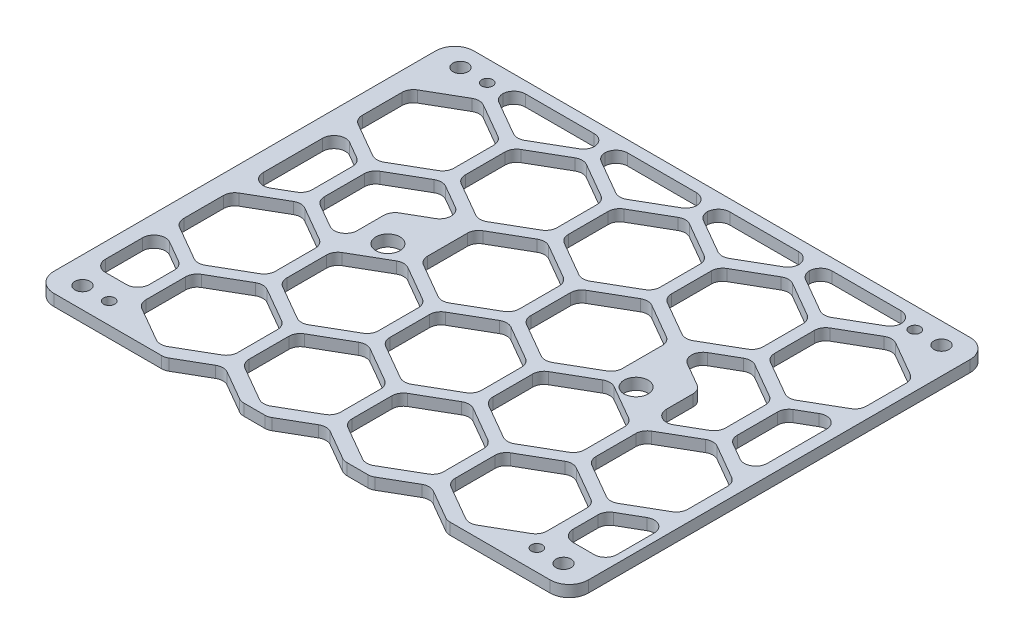
from build123d import *

# Parameters (mm, degrees)
SKETCH_1_W          = 140
SKETCH_1_H          = 110
SKETCH_1_R          = 1.975
SKETCH_1_R_2        = 1.45
EXTRUDE_1_DEPTH     = 1.5
FILLET_1_R          = 5
SKETCH_3_R          = 3.15
CUT_EXTRUDE_2_DEPTH = 90.073003767
CUT_EXTRUDE_3_DEPTH = 90.073003767
FILLET_2_R          = 3
FILLET_3_R          = 3


with BuildPart() as part:
    # 草图1 → 凸台-拉伸1 (new, symmetric)
    with BuildSketch(Plane(origin=(0, 0, 0), x_dir=(1, 0, 0), z_dir=(0, 1, 0))):
        Rectangle(SKETCH_1_W, SKETCH_1_H)
        with Locations(Location((-63, 49.5, 0), (0, 0, 270))):
            Circle(SKETCH_1_R, mode=Mode.SUBTRACT)
        with Locations(Location((63, 49.5, 0), (0, 0, 270))):
            Circle(SKETCH_1_R, mode=Mode.SUBTRACT)
        with Locations(Location((63, -49.5, 0), (0, 0, 270))):
            Circle(SKETCH_1_R, mode=Mode.SUBTRACT)
        with Locations(Location((-63, -49.5, 0), (0, 0, 270))):
            Circle(SKETCH_1_R, mode=Mode.SUBTRACT)
        with Locations(Location((-56, 49.5, 0), (0, 0, 270))):
            Circle(SKETCH_1_R_2, mode=Mode.SUBTRACT)
        with Locations(Location((56, 49.5, 0), (0, 0, 270))):
            Circle(SKETCH_1_R_2, mode=Mode.SUBTRACT)
        with Locations(Location((56, -49.5, 0), (0, 0, 270))):
            Circle(SKETCH_1_R_2, mode=Mode.SUBTRACT)
        with Locations(Location((-56, -49.5, 0), (0, 0, 270))):
            Circle(SKETCH_1_R_2, mode=Mode.SUBTRACT)
    extrude(amount=EXTRUDE_1_DEPTH, both=True)

    # 圆角1
    fillet_1_edges = [part.edges().sort_by_distance(p)[0] for p in [
        (70, 0, 55),
        (-70, 0, 55),
        (-70, 0, -55),
        (70, 0, -55),
    ]]
    fillet(fillet_1_edges, radius=FILLET_1_R)

    # 草图3 → 切除-拉伸2 (cut, through all)
    with BuildSketch(Plane(origin=(0, 1.5, 0), x_dir=(1, 0, 0), z_dir=(0, 1, 0))):
        with Locations(Location((-32.5, 0, 0), (0, 0, 270))):
            Circle(SKETCH_3_R)
        with Locations(Location((32.5, 0, 0), (0, 0, 270))):
            Circle(SKETCH_3_R)
    extrude(amount=-CUT_EXTRUDE_2_DEPTH, mode=Mode.SUBTRACT)

    # 草图4 → 切除-拉伸3 (cut, through all)
    with BuildSketch(Plane(origin=(0, 1.5, 0), x_dir=(1, 0, 0), z_dir=(0, 1, 0))):
        Polygon((-53, 44.856406461), (-65, 37.92820323), (-65, 24.07179677), (-53, 17.143593539), (-41, 24.07179677), (-41, 37.92820323), align=None)
        Polygon((-26, 44.856406461), (-38, 37.92820323), (-38, 24.07179677), (-26, 17.143593539), (-14, 24.07179677), (-14, 37.92820323), align=None)
        Polygon((1, 44.856406461), (-11, 37.92820323), (-11, 24.07179677), (1, 17.143593539), (13, 24.07179677), (13, 37.92820323), align=None)
        Polygon((28, 44.856406461), (16, 37.92820323), (16, 24.07179677), (28, 17.143593539), (40, 24.07179677), (40, 37.92820323), align=None)
        Polygon((55, 44.856406461), (43, 37.92820323), (43, 24.07179677), (55, 17.143593539), (67, 24.07179677), (67, 37.92820323), align=None)
        Polygon((-26, -1.913593539), (-38, -8.84179677), (-38, -22.69820323), (-26, -29.626406461), (-14, -22.69820323), (-14, -8.84179677), align=None)
        Polygon((1, -1.913593539), (-11, -8.84179677), (-11, -22.69820323), (1, -29.626406461), (13, -22.69820323), (13, -8.84179677), align=None)
        Polygon((28, -1.913593539), (16, -8.84179677), (16, -22.69820323), (28, -29.626406461), (40, -22.69820323), (40, -8.84179677), align=None)
        Polygon((55, -1.913593539), (43, -8.84179677), (43, -22.69820323), (55, -29.626406461), (67, -22.69820323), (67, -8.84179677), align=None)
        Polygon((-53, -1.913593539), (-65, -8.84179677), (-65, -22.69820323), (-53, -29.626406461), (-41, -22.69820323), (-41, -8.84179677), align=None)
        Polygon((-12.5, 21.473720558), (-24.5, 14.545517328), (-24.5, 0.689110868), (-12.5, -6.239092363), (-0.5, 0.689110868), (-0.5, 14.545517328), align=None)
        Polygon((14.5, 21.473720558), (2.5, 14.545517328), (2.5, 0.689110868), (14.5, -6.239092363), (26.5, 0.689110868), (26.5, 14.545517328), align=None)
        Polygon((-12.5, -25.296279442), (-24.5, -32.224482672), (-24.5, -46.080889132), (-12.5, -53.009092363), (-0.5, -46.080889132), (-0.5, -32.224482672), align=None)
        Polygon((14.5, -25.296279442), (2.5, -32.224482672), (2.5, -46.080889132), (14.5, -53.009092363), (26.5, -46.080889132), (26.5, -32.224482672), align=None)
        Polygon((41.5, -25.296279442), (29.5, -32.224482672), (29.5, -46.080889132), (41.5, -53.009092363), (53.5, -46.080889132), (53.5, -32.224482672), align=None)
        Polygon((-39.5, -25.296279442), (-51.5, -32.224482672), (-51.5, -46.080889132), (-39.5, -53.009092363), (-27.5, -46.080889132), (-27.5, -32.224482672), align=None)
        Polygon((-27.5, 14.545517328), (-39.5, 7.617314098), (-39.5, -6.239092363), (-51.5, 0.689110868), (-51.5, 14.545517328), (-39.5, 21.473720558), align=None)
        Polygon((29.5, 14.545517328), (41.5, 7.617314098), (41.5, -6.239092363), (53.5, 0.689110868), (53.5, 14.545517328), (41.5, 21.473720558), align=None)
        Polygon((-65, 20.57179677), (-54.682525344, 14.615), (-54.682525344, 0.615), (-65, -5.34179677), align=None)
        Polygon((56.682525344, 0.615), (67, -5.34179677), (67, 20.57179677), (56.682525344, 14.615), align=None)
        Polygon((-66, -25.584954576), (-66, -43.5), (-54.5, -43.5), (-54.5, -32.224482672), align=None)
        Polygon((56.5, -43.5), (56.5, -32.224482672), (68, -25.584954576), (68, -43.5), align=None)
        Polygon((-51.5, 52), (-51.5, 47.454482672), (-39.5, 40.526279442), (-27.5, 47.454482672), (-27.5, 52), align=None)
        Polygon((-0.725, 52), (-24.725, 52), (-24.725, 47.454482672), (-12.725, 40.526279442), (-0.725, 47.454482672), align=None)
        Polygon((26.05, 52), (2.05, 52), (2.05, 47.454482672), (14.05, 40.526279442), (26.05, 47.454482672), align=None)
        Polygon((52.825, 52), (28.825, 52), (28.825, 47.454482672), (40.825, 40.526279442), (52.825, 47.454482672), align=None)
        Polygon((-35.948353181, -55), (-26, -49.256315613), (-16.051646819, -55), align=None)
        Polygon((10.948353181, -55), (-8.948353181, -55), (1, -49.256315613), align=None)
        Polygon((37.948353181, -55), (18.051646819, -55), (28, -49.256315613), align=None)
    extrude(amount=-CUT_EXTRUDE_3_DEPTH, mode=Mode.SUBTRACT)

    # 圆角2
    # the kernel refuses this fillet: 3 mm, written as the material it adds along each edge
    with BuildSketch(Plane(origin=(41.5, 1.5, 6.239092363), x_dir=(0, 0, -1), z_dir=(0, -1, 0)), Plane(origin=(-39.5, 1.5, 6.239092363), x_dir=(-0.8660254037844385, 0, -0.5000000000000002), z_dir=(0, -1, 0)), Plane(origin=(-65, 1.5, 5.34179677), x_dir=(0, 0, -1), z_dir=(0, -1, 0)), Plane(origin=(67, 1.5, -20.57179677), x_dir=(0, 0, 1), z_dir=(0, -1, 0)), Plane(origin=(67, 1.5, 5.34179677), x_dir=(-0.8660254037844393, 0, -0.49999999999999906), z_dir=(0, -1, 0)), Plane(origin=(68, 1.5, 25.584954576), x_dir=(0, 0, 1), z_dir=(0, -1, 0))) as fillet_2_piece_1:
        with BuildLine():
            CenterArc((FILLET_2_R * 1.73205080757, FILLET_2_R), FILLET_2_R, 150, 120)
            Line((FILLET_2_R * 0.866025403784, FILLET_2_R * 1.5), (0, 0))
            Line((0, 0), (FILLET_2_R * 1.73205080757, 0))
        make_face()
    extrude(amount=3)
    with BuildSketch(Plane(origin=(29.5, 1.5, -14.545517328), x_dir=(0.8660254037844386, 0, 0.5), z_dir=(0, -1, 0)), Plane(origin=(-27.5, 1.5, -14.545517328), x_dir=(-0.8660254037844392, 0, -0.4999999999999992), z_dir=(0, -1, 0)), Plane(origin=(-65, 1.5, -20.57179677), x_dir=(0, 0, 1), z_dir=(0, -1, 0)), Plane(origin=(-66, 1.5, 25.584954576), x_dir=(0, 0, 1), z_dir=(0, -1, 0))) as fillet_2_piece_2:
        with BuildLine():
            CenterArc((FILLET_2_R * 1.73205080757, -FILLET_2_R), FILLET_2_R, 90, 120)
            Line((FILLET_2_R * 0.866025403784, -FILLET_2_R * 1.5), (0, 0))
            Line((0, 0), (FILLET_2_R * 1.73205080757, 0))
        make_face()
    extrude(amount=3)
    with BuildSketch(Plane(origin=(41.5, 1.5, -21.473720558), x_dir=(0.8660254037844389, 0, 0.4999999999999995), z_dir=(0, -1, 0)), Plane(origin=(53.5, 1.5, -14.545517328), x_dir=(0, 0, 1), z_dir=(0, -1, 0)), Plane(origin=(53.5, 1.5, -0.689110868), x_dir=(-0.8660254037844385, 0, 0.5000000000000003), z_dir=(0, -1, 0)), Plane(origin=(-51.5, 1.5, -0.689110868), x_dir=(0, 0, -1), z_dir=(0, -1, 0)), Plane(origin=(-51.5, 1.5, -14.545517328), x_dir=(0.8660254037844389, 0, -0.4999999999999995), z_dir=(0, -1, 0)), Plane(origin=(-39.5, 1.5, -21.473720558), x_dir=(0.8660254037844392, 0, 0.4999999999999993), z_dir=(0, -1, 0)), Plane(origin=(-41, 1.5, 8.84179677), x_dir=(0, 0, 1), z_dir=(0, -1, 0)), Plane(origin=(-41, 1.5, 22.69820323), x_dir=(-0.8660254037844379, 0, 0.5000000000000013), z_dir=(0, -1, 0)), Plane(origin=(-53, 1.5, 29.626406461), x_dir=(-0.8660254037844389, 0, -0.4999999999999995), z_dir=(0, -1, 0)), Plane(origin=(-65, 1.5, 22.69820323), x_dir=(0, 0, -1), z_dir=(0, -1, 0)), Plane(origin=(-65, 1.5, 8.84179677), x_dir=(0.8660254037844394, 0, -0.4999999999999987), z_dir=(0, -1, 0)), Plane(origin=(67, 1.5, 8.84179677), x_dir=(0, 0, 1), z_dir=(0, -1, 0)), Plane(origin=(67, 1.5, 22.69820323), x_dir=(-0.8660254037844389, 0, 0.4999999999999995), z_dir=(0, -1, 0)), Plane(origin=(55, 1.5, 29.626406461), x_dir=(-0.8660254037844389, 0, -0.4999999999999995), z_dir=(0, -1, 0)), Plane(origin=(43, 1.5, 22.69820323), x_dir=(0, 0, -1), z_dir=(0, -1, 0)), Plane(origin=(43, 1.5, 8.84179677), x_dir=(0.8660254037844394, 0, -0.4999999999999987), z_dir=(0, -1, 0)), Plane(origin=(-0.5, 1.5, -14.545517328), x_dir=(0, 0, 1), z_dir=(0, -1, 0)), Plane(origin=(-0.5, 1.5, -0.689110868), x_dir=(-0.866025403784439, 0, 0.4999999999999993), z_dir=(0, -1, 0)), Plane(origin=(-12.5, 1.5, 6.239092363), x_dir=(-0.8660254037844387, 0, -0.4999999999999999), z_dir=(0, -1, 0)), Plane(origin=(-24.5, 1.5, -0.689110868), x_dir=(0, 0, -1), z_dir=(0, -1, 0)), Plane(origin=(-24.5, 1.5, -14.545517328), x_dir=(0.8660254037844384, 0, -0.5000000000000003), z_dir=(0, -1, 0)), Plane(origin=(26.5, 1.5, -14.545517328), x_dir=(0, 0, 1), z_dir=(0, -1, 0)), Plane(origin=(26.5, 1.5, -0.689110868), x_dir=(-0.8660254037844385, 0, 0.5000000000000002), z_dir=(0, -1, 0)), Plane(origin=(14.5, 1.5, 6.239092363), x_dir=(-0.8660254037844387, 0, -0.4999999999999999), z_dir=(0, -1, 0)), Plane(origin=(2.5, 1.5, -0.689110868), x_dir=(0, 0, -1), z_dir=(0, -1, 0)), Plane(origin=(2.5, 1.5, -14.545517328), x_dir=(0.8660254037844386, 0, -0.5000000000000002), z_dir=(0, -1, 0)), Plane(origin=(-0.5, 1.5, 32.224482672), x_dir=(0, 0, 1), z_dir=(0, -1, 0)), Plane(origin=(-0.5, 1.5, 46.080889132), x_dir=(-0.8660254037844382, 0, 0.500000000000001), z_dir=(0, -1, 0)), Plane(origin=(-12.5, 1.5, 53.009092363), x_dir=(-0.8660254037844378, 0, -0.5000000000000014), z_dir=(0, -1, 0)), Plane(origin=(-24.5, 1.5, 46.080889132), x_dir=(0, 0, -1), z_dir=(0, -1, 0)), Plane(origin=(-24.5, 1.5, 32.224482672), x_dir=(0.8660254037844398, 0, -0.49999999999999795), z_dir=(0, -1, 0)), Plane(origin=(26.5, 1.5, 32.224482672), x_dir=(0, 0, 1), z_dir=(0, -1, 0)), Plane(origin=(26.5, 1.5, 46.080889132), x_dir=(-0.866025403784438, 0, 0.500000000000001), z_dir=(0, -1, 0)), Plane(origin=(14.5, 1.5, 53.009092363), x_dir=(-0.8660254037844378, 0, -0.5000000000000014), z_dir=(0, -1, 0)), Plane(origin=(2.5, 1.5, 46.080889132), x_dir=(0, 0, -1), z_dir=(0, -1, 0)), Plane(origin=(2.5, 1.5, 32.224482672), x_dir=(0.8660254037844384, 0, -0.5000000000000006), z_dir=(0, -1, 0)), Plane(origin=(-54.682525344, 1.5, -14.615), x_dir=(0, 0, 1), z_dir=(0, -1, 0)), Plane(origin=(-54.682525344, 1.5, -0.615), x_dir=(-0.8660254037844389, 0, 0.49999999999999944), z_dir=(0, -1, 0)), Plane(origin=(-14, 1.5, -37.92820323), x_dir=(0, 0, 1), z_dir=(0, -1, 0)), Plane(origin=(-14, 1.5, -24.07179677), x_dir=(-0.8660254037844387, 0, 0.49999999999999994), z_dir=(0, -1, 0)), Plane(origin=(-26, 1.5, -17.143593539), x_dir=(-0.8660254037844385, 0, -0.5000000000000001), z_dir=(0, -1, 0)), Plane(origin=(-38, 1.5, -24.07179677), x_dir=(0, 0, -1), z_dir=(0, -1, 0)), Plane(origin=(-38, 1.5, -37.92820323), x_dir=(0.866025403784438, 0, -0.500000000000001), z_dir=(0, -1, 0)), Plane(origin=(13, 1.5, -37.92820323), x_dir=(0, 0, 1), z_dir=(0, -1, 0)), Plane(origin=(13, 1.5, -24.07179677), x_dir=(-0.8660254037844384, 0, 0.5000000000000003), z_dir=(0, -1, 0)), Plane(origin=(1, 1.5, -17.143593539), x_dir=(-0.8660254037844387, 0, -0.4999999999999999), z_dir=(0, -1, 0)), Plane(origin=(-11, 1.5, -24.07179677), x_dir=(0, 0, -1), z_dir=(0, -1, 0)), Plane(origin=(-11, 1.5, -37.92820323), x_dir=(0.866025403784438, 0, -0.500000000000001), z_dir=(0, -1, 0)), Plane(origin=(40, 1.5, -37.92820323), x_dir=(0, 0, 1), z_dir=(0, -1, 0)), Plane(origin=(40, 1.5, -24.07179677), x_dir=(-0.8660254037844388, 0, 0.4999999999999997), z_dir=(0, -1, 0)), Plane(origin=(28, 1.5, -17.143593539), x_dir=(-0.8660254037844384, 0, -0.5000000000000003), z_dir=(0, -1, 0)), Plane(origin=(16, 1.5, -24.07179677), x_dir=(0, 0, -1), z_dir=(0, -1, 0)), Plane(origin=(16, 1.5, -37.92820323), x_dir=(0.8660254037844383, 0, -0.5000000000000006), z_dir=(0, -1, 0)), Plane(origin=(40, 1.5, 8.84179677), x_dir=(0, 0, 1), z_dir=(0, -1, 0)), Plane(origin=(40, 1.5, 22.69820323), x_dir=(-0.8660254037844389, 0, 0.4999999999999995), z_dir=(0, -1, 0)), Plane(origin=(28, 1.5, 29.626406461), x_dir=(-0.8660254037844389, 0, -0.4999999999999995), z_dir=(0, -1, 0)), Plane(origin=(16, 1.5, 22.69820323), x_dir=(0, 0, -1), z_dir=(0, -1, 0)), Plane(origin=(16, 1.5, 8.84179677), x_dir=(0.8660254037844385, 0, -0.5000000000000002), z_dir=(0, -1, 0)), Plane(origin=(13, 1.5, 8.84179677), x_dir=(0, 0, 1), z_dir=(0, -1, 0)), Plane(origin=(13, 1.5, 22.69820323), x_dir=(-0.8660254037844387, 0, 0.49999999999999994), z_dir=(0, -1, 0)), Plane(origin=(1, 1.5, 29.626406461), x_dir=(-0.8660254037844387, 0, -0.5), z_dir=(0, -1, 0)), Plane(origin=(-11, 1.5, 22.69820323), x_dir=(0, 0, -1), z_dir=(0, -1, 0)), Plane(origin=(-11, 1.5, 8.84179677), x_dir=(0.8660254037844387, 0, -0.49999999999999983), z_dir=(0, -1, 0)), Plane(origin=(-14, 1.5, 8.84179677), x_dir=(0, 0, 1), z_dir=(0, -1, 0)), Plane(origin=(-14, 1.5, 22.69820323), x_dir=(-0.8660254037844383, 0, 0.5000000000000006), z_dir=(0, -1, 0)), Plane(origin=(-26, 1.5, 29.626406461), x_dir=(-0.8660254037844389, 0, -0.4999999999999995), z_dir=(0, -1, 0)), Plane(origin=(-38, 1.5, 22.69820323), x_dir=(0, 0, -1), z_dir=(0, -1, 0)), Plane(origin=(-38, 1.5, 8.84179677), x_dir=(0.8660254037844389, 0, -0.4999999999999995), z_dir=(0, -1, 0)), Plane(origin=(67, 1.5, -37.92820323), x_dir=(0, 0, 1), z_dir=(0, -1, 0)), Plane(origin=(67, 1.5, -24.07179677), x_dir=(-0.8660254037844389, 0, 0.4999999999999995), z_dir=(0, -1, 0)), Plane(origin=(55, 1.5, -17.143593539), x_dir=(-0.8660254037844389, 0, -0.4999999999999995), z_dir=(0, -1, 0)), Plane(origin=(43, 1.5, -24.07179677), x_dir=(0, 0, -1), z_dir=(0, -1, 0)), Plane(origin=(43, 1.5, -37.92820323), x_dir=(0.866025403784438, 0, -0.500000000000001), z_dir=(0, -1, 0)), Plane(origin=(28.825, 1.5, -47.454482672), x_dir=(0, 0, -1), z_dir=(0, -1, 0)), Plane(origin=(52.825, 1.5, -47.454482672), x_dir=(-0.8660254037844392, 0, 0.4999999999999993), z_dir=(0, -1, 0)), Plane(origin=(40.825, 1.5, -40.526279442), x_dir=(-0.866025403784438, 0, -0.500000000000001), z_dir=(0, -1, 0)), Plane(origin=(2.05, 1.5, -47.454482672), x_dir=(0, 0, -1), z_dir=(0, -1, 0)), Plane(origin=(26.05, 1.5, -47.454482672), x_dir=(-0.8660254037844385, 0, 0.5000000000000001), z_dir=(0, -1, 0)), Plane(origin=(14.05, 1.5, -40.526279442), x_dir=(-0.8660254037844383, 0, -0.5000000000000006), z_dir=(0, -1, 0)), Plane(origin=(-54.5, 1.5, 32.224482672), x_dir=(0, 0, 1), z_dir=(0, -1, 0)), Plane(origin=(56.682525344, 1.5, -14.615), x_dir=(0.8660254037844384, 0, -0.5000000000000006), z_dir=(0, -1, 0)), Plane(origin=(-27.5, 1.5, 32.224482672), x_dir=(0, 0, 1), z_dir=(0, -1, 0)), Plane(origin=(-27.5, 1.5, 46.080889132), x_dir=(-0.8660254037844385, 0, 0.5000000000000001), z_dir=(0, -1, 0)), Plane(origin=(-39.5, 1.5, 53.009092363), x_dir=(-0.866025403784438, 0, -0.500000000000001), z_dir=(0, -1, 0)), Plane(origin=(-51.5, 1.5, 46.080889132), x_dir=(0, 0, -1), z_dir=(0, -1, 0)), Plane(origin=(-51.5, 1.5, 32.224482672), x_dir=(0.8660254037844398, 0, -0.49999999999999795), z_dir=(0, -1, 0)), Plane(origin=(53.5, 1.5, 32.224482672), x_dir=(0, 0, 1), z_dir=(0, -1, 0)), Plane(origin=(53.5, 1.5, 46.080889132), x_dir=(-0.8660254037844392, 0, 0.4999999999999993), z_dir=(0, -1, 0)), Plane(origin=(41.5, 1.5, 53.009092363), x_dir=(-0.866025403784438, 0, -0.500000000000001), z_dir=(0, -1, 0)), Plane(origin=(29.5, 1.5, 46.080889132), x_dir=(0, 0, -1), z_dir=(0, -1, 0)), Plane(origin=(29.5, 1.5, 32.224482672), x_dir=(0.8660254037844398, 0, -0.49999999999999795), z_dir=(0, -1, 0)), Plane(origin=(-24.725, 1.5, -47.454482672), x_dir=(0, 0, -1), z_dir=(0, -1, 0)), Plane(origin=(-0.725, 1.5, -47.454482672), x_dir=(-0.866025403784438, 0, 0.5000000000000009), z_dir=(0, -1, 0)), Plane(origin=(-12.725, 1.5, -40.526279442), x_dir=(-0.8660254037844376, 0, -0.5000000000000019), z_dir=(0, -1, 0)), Plane(origin=(-27.5, 1.5, -47.454482672), x_dir=(-0.8660254037844385, 0, 0.5000000000000001), z_dir=(0, -1, 0)), Plane(origin=(-39.5, 1.5, -40.526279442), x_dir=(-0.8660254037844388, 0, -0.4999999999999997), z_dir=(0, -1, 0)), Plane(origin=(-51.5, 1.5, -47.454482672), x_dir=(0, 0, -1), z_dir=(0, -1, 0)), Plane(origin=(56.5, 1.5, 32.224482672), x_dir=(0.8660254037844363, 0, -0.5000000000000041), z_dir=(0, -1, 0)), Plane(origin=(-41, 1.5, -37.92820323), x_dir=(0, 0, 1), z_dir=(0, -1, 0)), Plane(origin=(-41, 1.5, -24.07179677), x_dir=(-0.8660254037844388, 0, 0.4999999999999997), z_dir=(0, -1, 0)), Plane(origin=(-53, 1.5, -17.143593539), x_dir=(-0.8660254037844389, 0, -0.4999999999999995), z_dir=(0, -1, 0)), Plane(origin=(-65, 1.5, -24.07179677), x_dir=(0, 0, -1), z_dir=(0, -1, 0)), Plane(origin=(-65, 1.5, -37.92820323), x_dir=(0.8660254037844388, 0, -0.4999999999999997), z_dir=(0, -1, 0))) as fillet_2_piece_3:
        with BuildLine():
            CenterArc((FILLET_2_R * 0.57735026919, FILLET_2_R), FILLET_2_R, 210, 60)
            Line((-FILLET_2_R * 0.288675134595, FILLET_2_R * 0.5), (0, 0))
            Line((0, 0), (FILLET_2_R * 0.57735026919, 0))
        make_face()
    extrude(amount=3)
    with BuildSketch(Plane(origin=(-53, 1.5, 1.913593539), x_dir=(-0.8660254037844388, 0, 0.49999999999999967), z_dir=(0, -1, 0)), Plane(origin=(55, 1.5, 1.913593539), x_dir=(-0.8660254037844388, 0, 0.49999999999999967), z_dir=(0, -1, 0)), Plane(origin=(-12.5, 1.5, -21.473720558), x_dir=(-0.8660254037844387, 0, 0.49999999999999994), z_dir=(0, -1, 0)), Plane(origin=(14.5, 1.5, -21.473720558), x_dir=(-0.8660254037844387, 0, 0.49999999999999994), z_dir=(0, -1, 0)), Plane(origin=(-12.5, 1.5, 25.296279442), x_dir=(-0.8660254037844387, 0, 0.49999999999999994), z_dir=(0, -1, 0)), Plane(origin=(14.5, 1.5, 25.296279442), x_dir=(-0.8660254037844387, 0, 0.49999999999999994), z_dir=(0, -1, 0)), Plane(origin=(-26, 1.5, -44.856406461), x_dir=(-0.8660254037844393, 0, 0.49999999999999883), z_dir=(0, -1, 0)), Plane(origin=(1, 1.5, -44.856406461), x_dir=(-0.8660254037844383, 0, 0.5000000000000007), z_dir=(0, -1, 0)), Plane(origin=(28, 1.5, -44.856406461), x_dir=(-0.8660254037844393, 0, 0.49999999999999883), z_dir=(0, -1, 0)), Plane(origin=(28, 1.5, 1.913593539), x_dir=(-0.8660254037844386, 0, 0.5000000000000001), z_dir=(0, -1, 0)), Plane(origin=(1, 1.5, 1.913593539), x_dir=(-0.8660254037844386, 0, 0.5), z_dir=(0, -1, 0)), Plane(origin=(-26, 1.5, 1.913593539), x_dir=(-0.8660254037844386, 0, 0.5000000000000001), z_dir=(0, -1, 0)), Plane(origin=(55, 1.5, -44.856406461), x_dir=(-0.8660254037844392, 0, 0.4999999999999993), z_dir=(0, -1, 0)), Plane(origin=(56.682525344, 1.5, -0.615), x_dir=(0.8660254037844392, 0, 0.4999999999999991), z_dir=(0, -1, 0)), Plane(origin=(-39.5, 1.5, 25.296279442), x_dir=(-0.8660254037844392, 0, 0.4999999999999993), z_dir=(0, -1, 0)), Plane(origin=(41.5, 1.5, 25.296279442), x_dir=(-0.8660254037844389, 0, 0.4999999999999995), z_dir=(0, -1, 0)), Plane(origin=(-53, 1.5, -44.856406461), x_dir=(-0.866025403784438, 0, 0.500000000000001), z_dir=(0, -1, 0))) as fillet_2_piece_4:
        with BuildLine():
            CenterArc((FILLET_2_R * 0.57735026919, -FILLET_2_R), FILLET_2_R, 90, 60)
            Line((-FILLET_2_R * 0.288675134595, -FILLET_2_R * 0.5), (0, 0))
            Line((0, 0), (FILLET_2_R * 0.57735026919, 0))
        make_face()
    extrude(amount=3)
    with BuildSketch(Plane(origin=(28.825, 1.5, -52), x_dir=(1, 0, 0), z_dir=(0, -1, 0)), Plane(origin=(2.05, 1.5, -52), x_dir=(1, 0, 0), z_dir=(0, -1, 0)), Plane(origin=(-54.5, 1.5, 43.5), x_dir=(-1, 0, 0), z_dir=(0, -1, 0)), Plane(origin=(-66, 1.5, 43.5), x_dir=(0, 0, -1), z_dir=(0, -1, 0)), Plane(origin=(-24.725, 1.5, -52), x_dir=(1, 0, 0), z_dir=(0, -1, 0)), Plane(origin=(-27.5, 1.5, -52), x_dir=(0, 0, 1), z_dir=(0, -1, 0)), Plane(origin=(68, 1.5, 43.5), x_dir=(-1, 0, 0), z_dir=(0, -1, 0))) as fillet_2_piece_5:
        with BuildLine():
            CenterArc((FILLET_2_R, FILLET_2_R), FILLET_2_R, 180, 90)
            Line((0, FILLET_2_R), (0, 0))
            Line((0, 0), (FILLET_2_R, 0))
        make_face()
    extrude(amount=3)
    with BuildSketch(Plane(origin=(52.825, 1.5, -52), x_dir=(-1, 0, 0), z_dir=(0, -1, 0)), Plane(origin=(26.05, 1.5, -52), x_dir=(-1, 0, 0), z_dir=(0, -1, 0)), Plane(origin=(-0.725, 1.5, -52), x_dir=(-1, 0, 0), z_dir=(0, -1, 0)), Plane(origin=(-51.5, 1.5, -52), x_dir=(0, 0, 1), z_dir=(0, -1, 0)), Plane(origin=(56.5, 1.5, 43.5), x_dir=(1, 0, 0), z_dir=(0, -1, 0))) as fillet_2_piece_6:
        with BuildLine():
            CenterArc((FILLET_2_R, -FILLET_2_R), FILLET_2_R, 90, 90)
            Line((0, -FILLET_2_R), (0, 0))
            Line((0, 0), (FILLET_2_R, 0))
        make_face()
    extrude(amount=3)
    # the kernel refuses this fillet: 3 mm, written as the material it takes off along each edge
    with BuildSketch(Plane(origin=(41.5, 5.830127019, -7.617314098), x_dir=(-0.8660254037844392, 0, -0.4999999999999991), z_dir=(0, -1, 0)), Plane(origin=(-39.5, 5.830127019, -7.617314098), x_dir=(0, 0, 1), z_dir=(0, -1, 0))) as fillet_2_2_piece_1:
        with BuildLine():
            CenterArc((FILLET_2_R * 0.57735026919, -FILLET_2_R), FILLET_2_R, 90, 60)
            Line((-FILLET_2_R * 0.288675134595, -FILLET_2_R * 0.5), (0, 0))
            Line((0, 0), (FILLET_2_R * 0.57735026919, 0))
        make_face()
    extrude(amount=11.660254038, mode=Mode.SUBTRACT)

    # 圆角3
    fillet_3_edges = [part.edges().sort_by_distance(p)[0] for p in [
        (18.051646819, 0, 55),
        (28, 0, 49.256315613),
        (37.948353181, 0, 55),
        (-8.948353181, 0, 55),
        (1, 0, 49.256315613),
        (10.948353181, 0, 55),
        (-16.051646819, 0, 55),
        (-35.948353181, 0, 55),
        (-26, 0, 49.256315613),
    ]]
    fillet(fillet_3_edges, radius=FILLET_3_R)


solid = part.part
